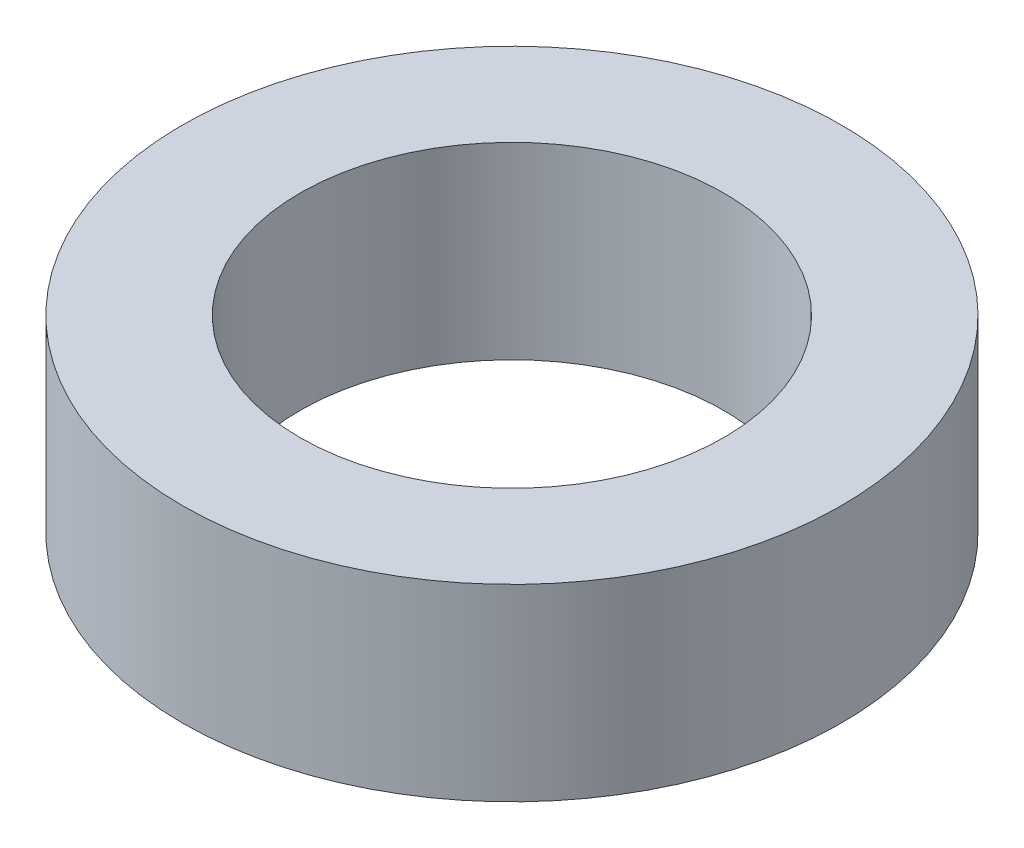
from build123d import *

# Parameters (mm, degrees)
SKETCH1_R           = 7
SKETCH1_R_2         = 4.5
BOSS_EXTRUDE1_DEPTH = 4


with BuildPart() as part:
    # Sketch1 → Boss-Extrude1 (new body)
    with BuildSketch(Plane(origin=(0, 0, 0), x_dir=(1, 0, 0), z_dir=(0, 1, 0))):
        Circle(SKETCH1_R)
        Circle(SKETCH1_R_2, mode=Mode.SUBTRACT)
    extrude(amount=BOSS_EXTRUDE1_DEPTH)


solid = part.part
